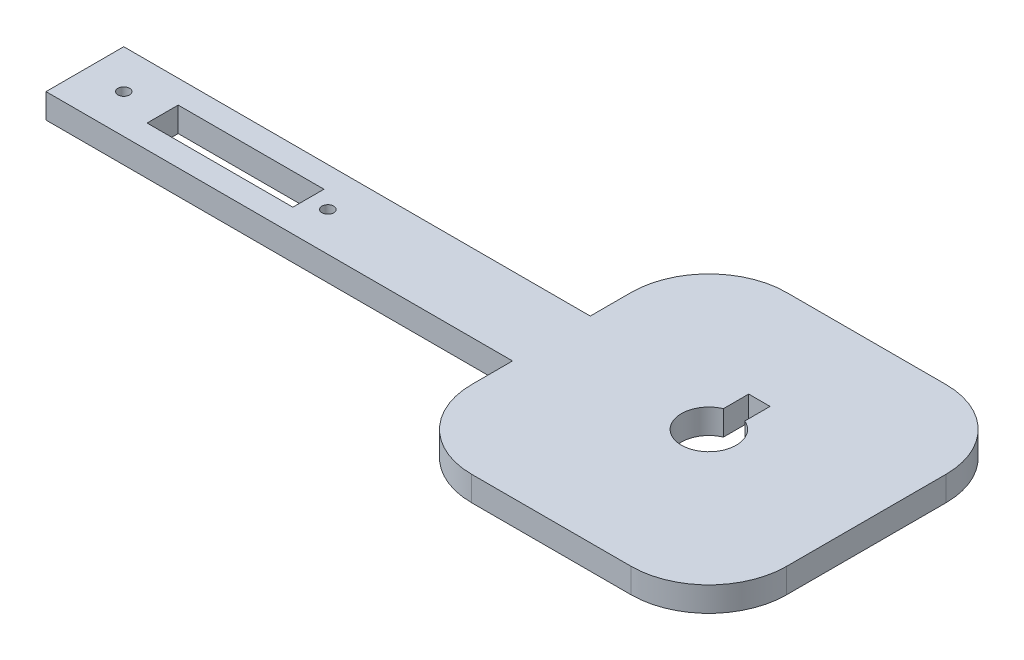
from build123d import *

# Parameters (mm, degrees)
SKETCH1_R           = 1.5
SKETCH1_W           = 37.5
SKETCH1_H           = 8
BOSS_EXTRUDE1_DEPTH = 6.35
FILLET1_R           = 20


with BuildPart() as part:
    # Sketch1 → Boss-Extrude1 (new body)
    with BuildSketch(Plane(origin=(0, 0, 0), x_dir=(1, 0, 0), z_dir=(0, 1, 0))):
        Polygon((-40.5, 40.5), (40.5, 40.5), (40.5, -40.5), (-40.5, -40.5), (-40.5, -10), (-140.5, -10), (-160.5, -10), (-160.5, 10), (-140.5, 10), (-40.5, 10), align=None)
        with Locations((-98, 0)):
            Circle(SKETCH1_R, mode=Mode.SUBTRACT)
        with Locations((-150.5, 0)):
            Circle(SKETCH1_R, mode=Mode.SUBTRACT)
        with BuildLine():
            Line((-2.75, 6.491532947), (-2.75, 13))
            Line((-2.75, 13), (2.75, 13))
            Line((2.75, 13), (2.75, 6.491532947))
            ThreePointArc((2.75, 6.491532947), (0, -7.05), (-2.75, 6.491532947))
        make_face(mode=Mode.SUBTRACT)
        with Locations((-121.75, 0)):
            Rectangle(SKETCH1_W, SKETCH1_H, mode=Mode.SUBTRACT)
    extrude(amount=BOSS_EXTRUDE1_DEPTH)

    # Fillet1
    fillet1_edges = [part.edges().sort_by_distance(p)[0] for p in [
        (-40.5, 3.175, -40.5),
        (40.5, 3.175, -40.5),
        (40.5, 3.175, 40.5),
        (-40.5, 3.175, 40.5),
    ]]
    fillet(fillet1_edges, radius=FILLET1_R)


solid = part.part
